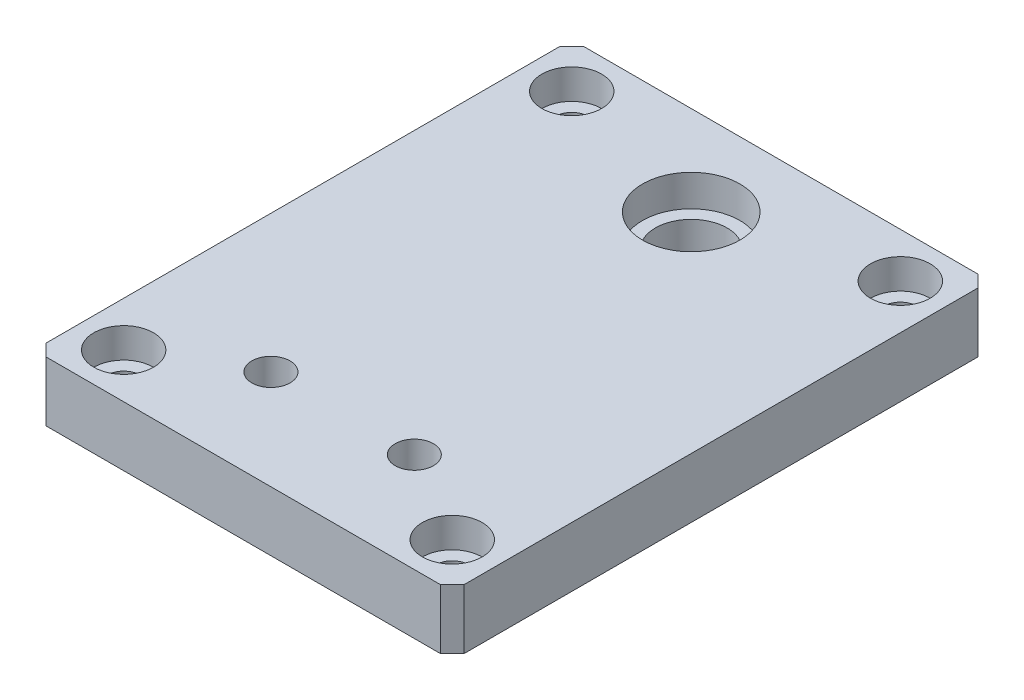
from build123d import *

# Parameters (mm, degrees)
SKETCH1_W                      = 70
SKETCH1_H                      = 90
BOSS_EXTRUDE1_DEPTH            = 10
CBORE_FOR_M5_SHCS1_D           = 5.5
CBORE_FOR_M5_SHCS1_CBORE_D     = 10
CBORE_FOR_M5_SHCS1_CBORE_DEPTH = 5
F_1_0MM_DOWEL_HOLE1_D          = 16.3
F_1_0MM_DOWEL_HOLE1_DEPTH      = 5.3
F_1_0MM_DOWEL_HOLE3_D          = 12
SKETCH14_R                     = 3.2
CUT_EXTRUDE1_DEPTH             = 58.879184514
CHAMFER1_SIZE                  = 2


with BuildPart() as part:
    # Sketch1 → Boss-Extrude1 (new body)
    with BuildSketch(Plane(origin=(0, 0, 0), x_dir=(1, 0, 0), z_dir=(0, 1, 0))):
        Rectangle(SKETCH1_W, SKETCH1_H)
    extrude(amount=BOSS_EXTRUDE1_DEPTH)

    # CBORE for M5 SHCS1 (through all)
    with Locations(Plane(origin=(0, 10, 0), x_dir=(1, 0, 0), z_dir=(0, 1, 0))):
        with Locations((-27.5, -37.5), (-27.5, 37.5), (27.5, 37.5), (27.5, -37.5)):
            CounterBoreHole(CBORE_FOR_M5_SHCS1_D / 2, CBORE_FOR_M5_SHCS1_CBORE_D / 2, CBORE_FOR_M5_SHCS1_CBORE_DEPTH)

    # Ø1.0mm Dowel Hole1
    with Locations(Plane(origin=(0, 10, 0), x_dir=(1, 0, 0), z_dir=(0, 1, 0))):
        with Locations((0, 30)):
            Hole(F_1_0MM_DOWEL_HOLE1_D / 2, depth=F_1_0MM_DOWEL_HOLE1_DEPTH)

    # Ø1.0mm Dowel Hole3 (through all)
    with Locations(Plane(origin=(0, 4.7, 0), x_dir=(1, 0, 0), z_dir=(0, 1, 0))):
        with Locations((0, 30)):
            Hole(F_1_0MM_DOWEL_HOLE3_D / 2)

    # Sketch14 → Cut-Extrude1 (cut, through all)
    with BuildSketch(Plane(origin=(0, 10, 0), x_dir=(1, 0, 0), z_dir=(0, 1, 0))):
        with Locations((12, -28.35)):
            Circle(SKETCH14_R)
        with Locations((-12, -28.35)):
            Circle(SKETCH14_R)
    extrude(amount=-CUT_EXTRUDE1_DEPTH, mode=Mode.SUBTRACT)

    # Chamfer1
    chamfer1_edges = [part.edges().sort_by_distance(p)[0] for p in [
        (35, 5, 45),
        (35, 5, -45),
        (-35, 5, -45),
        (-35, 5, 45),
    ]]
    chamfer(chamfer1_edges, length=CHAMFER1_SIZE)


solid = part.part
